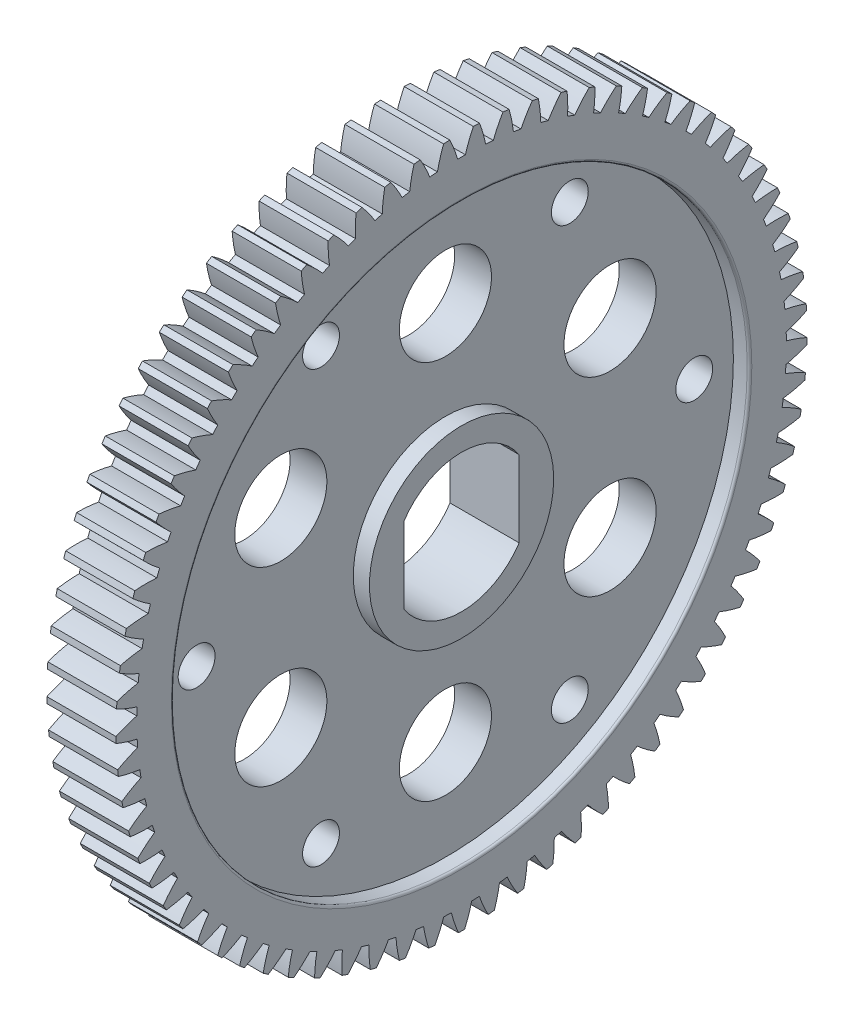
from build123d import *

# Parameters (mm, degrees)
BASPROSKE_W              = 15
BASPROSKE_H              = 75
TOOTHCUT_DEPTH           = 108.121426428
TEETHCUTS_COUNT          = 73
TEETHCUTS_ANGLE          = 355.068493151
BORSKE_R                 = 0.4
BORE_DEPTH               = 50.0000508
SKETCH1_R                = 62.5
CUT_EXTRUDE1_DEPTH       = 3.5
CUT_EXTRUDE2_START       = -11.5
SKETCH1_2_R              = 62.5
CUT_EXTRUDE2_DEPTH       = 3.5
FILLET1_R                = 0.5
FILLET2_R                = 0.5
BOSS_EXTRUDE1_DEPTH      = 3.5
BOSS_EXTRUDE1_DEPTH_BACK = 11.5
SKETCH2_R                = 20
CUT_EXTRUDE3_REACH       = 109.117
CUT_EXTRUDE4_REACH       = 108.683
SKETCH4_R                = 10
SKETCH4_R_2              = 4
CIRPATTERN1_COUNT        = 6


with BuildPart() as part:
    # BasProSke → Base-Revolve (revolve)
    with BuildSketch(Plane(origin=(0, 0, 0), x_dir=(1, 0, 0), z_dir=(0, 1, 0)), mode=Mode.PRIVATE) as base_revolve_sk:
        with Locations((7.5, 37.5)):
            Rectangle(BASPROSKE_W, BASPROSKE_H)
    revolve(base_revolve_sk.sketch.rotate(Axis((-10, 0, 0), (1, 0, 0)), 180), axis=Axis((-10, 0, 0), (1, 0, 0)))

    # TooCutSke → ToothCut (cut, through all)
    with BuildSketch(Plane(origin=(0, 0, 0), x_dir=(0, 0, -1), z_dir=(1, 0, 0))):
        with BuildLine():
            ThreePointArc((0.831762675, 70.49409317), (0, 70.499), (-0.831762675, 70.49409317))
            ThreePointArc((-0.831762675, 70.49409317), (-1.606990857, 72.773584485), (-2.567381061, 74.981459039))
            ThreePointArc((-2.567381061, 74.981459039), (0, 75.0254), (2.567381061, 74.981459039))
            ThreePointArc((2.567381061, 74.981459039), (1.606990857, 72.773584485), (0.831762675, 70.49409317))
        make_face()
    toothcut = extrude(amount=TOOTHCUT_DEPTH, mode=Mode.SUBTRACT)

    # TeethCuts: ToothCut ×73 about axis
    teethcuts_axis = Axis((-10, 0, 0), (1, 0, 0))
    for i in range(1, TEETHCUTS_COUNT):
        add(toothcut.rotate(teethcuts_axis, i * TEETHCUTS_ANGLE / (TEETHCUTS_COUNT - 1)), mode=Mode.SUBTRACT)

    # BorSke → Bore (cut, symmetric)
    with BuildSketch(Plane(origin=(0, 0, 0), x_dir=(0, 0, -1), z_dir=(1, 0, 0))):
        with Locations(Location((0, 0, 0), (0, 0, 180))):
            Circle(BORSKE_R)
    extrude(amount=BORE_DEPTH, both=True, mode=Mode.SUBTRACT)

    # Sketch1 → Cut-Extrude1 (cut)
    with BuildSketch(Plane(origin=(15, 0, 0), x_dir=(0, 0, -1), z_dir=(1, 0, 0))):
        with Locations((0, -0.4)):
            Circle(SKETCH1_R)
    extrude(amount=-CUT_EXTRUDE1_DEPTH, mode=Mode.SUBTRACT)

    # Sketch1<2> → Cut-Extrude2 (cut)
    with BuildSketch(Plane(origin=(15, 0, 0), x_dir=(0, 0, -1), z_dir=(1, 0, 0)).offset(CUT_EXTRUDE2_START)):
        with Locations((0, -0.4)):
            Circle(SKETCH1_2_R)
    extrude(amount=-CUT_EXTRUDE2_DEPTH, mode=Mode.SUBTRACT)

    # Fillet1
    fillet1_edges = [part.edges().sort_by_distance(p)[0] for p in [
        (15, -0.4, 62.5),
    ]]
    fillet(fillet1_edges, radius=FILLET1_R)

    # Fillet2
    fillet2_edges = [part.edges().sort_by_distance(p)[0] for p in [
        (0, -0.4, 62.5),
    ]]
    fillet(fillet2_edges, radius=FILLET2_R)

    # Sketch2 → Boss-Extrude1 (add, two sides: drawn at the far end of the back side and taken through both)
    with BuildSketch(Plane(origin=(11.5, 0, 0), x_dir=(0, 0, -1), z_dir=(1, 0, 0)).offset(-BOSS_EXTRUDE1_DEPTH_BACK)):
        Circle(SKETCH2_R)
    extrude(amount=BOSS_EXTRUDE1_DEPTH + BOSS_EXTRUDE1_DEPTH_BACK)

    # Sketch3 → Cut-Extrude3 (cut, up to next)
    with BuildSketch(Plane(origin=(15, 0, 0), x_dir=(0, 0, -1), z_dir=(1, 0, 0)), mode=Mode.PRIVATE) as cut_extrude3_sk1:
        with BuildLine():
            Line((-12.5, 8.291561976), (-12.5, -8.291561976))
            ThreePointArc((-12.5, -8.291561976), (0, -15), (12.5, -8.291561976))
            Line((12.5, -8.291561976), (12.5, 8.291561976))
            ThreePointArc((12.5, 8.291561976), (0, 15), (-12.5, 8.291561976))
        make_face()
    cut_extrude3_tool1 = extrude(cut_extrude3_sk1.sketch, amount=-CUT_EXTRUDE3_REACH, mode=Mode.PRIVATE) & part.part
    add(cut_extrude3_tool1.solids().sort_by_distance((15, 0, 0))[0], mode=Mode.SUBTRACT)

    # Sketch4 → Cut-Extrude4 (cut, up to next)
    with BuildSketch(Plane(origin=(11.5, 0, 0), x_dir=(0, 0, -1), z_dir=(1, 0, 0)), mode=Mode.PRIVATE) as cut_extrude4_sk1:
        with Locations((0, 41.25)):
            Circle(SKETCH4_R)
    cut_extrude4_tool1 = extrude(cut_extrude4_sk1.sketch, amount=-CUT_EXTRUDE4_REACH, mode=Mode.PRIVATE) & part.part
    # Sketch4 → Cut-Extrude4 (cut, up to next)
    with BuildSketch(Plane(origin=(11.5, 0, 0), x_dir=(0, 0, -1), z_dir=(1, 0, 0)), mode=Mode.PRIVATE) as cut_extrude4_sk2:
        with Locations((27, 46.765371804)):
            Circle(SKETCH4_R_2)
    cut_extrude4_tool2 = extrude(cut_extrude4_sk2.sketch, amount=-CUT_EXTRUDE4_REACH, mode=Mode.PRIVATE) & part.part
    cut_extrude4_1 = cut_extrude4_tool1.solids().sort_by_distance((11.5, 41.25, 0))[0]
    add(cut_extrude4_1, mode=Mode.SUBTRACT)
    cut_extrude4_2 = cut_extrude4_tool2.solids().sort_by_distance((11.5, 46.765372, -27))[0]
    add(cut_extrude4_2, mode=Mode.SUBTRACT)
    cut_extrude4 = cut_extrude4_1 + cut_extrude4_2  # Cut-Extrude4 as one shape, for the pattern or mirror that repeats it

    # CirPattern1: Cut-Extrude4 ×6 about axis
    cirpattern1_axis = Axis((0, 0, 0), (1, 0, 0))
    for i in range(1, CIRPATTERN1_COUNT):
        add(cut_extrude4.rotate(cirpattern1_axis, i * 360 / CIRPATTERN1_COUNT), mode=Mode.SUBTRACT)


solid = part.part
